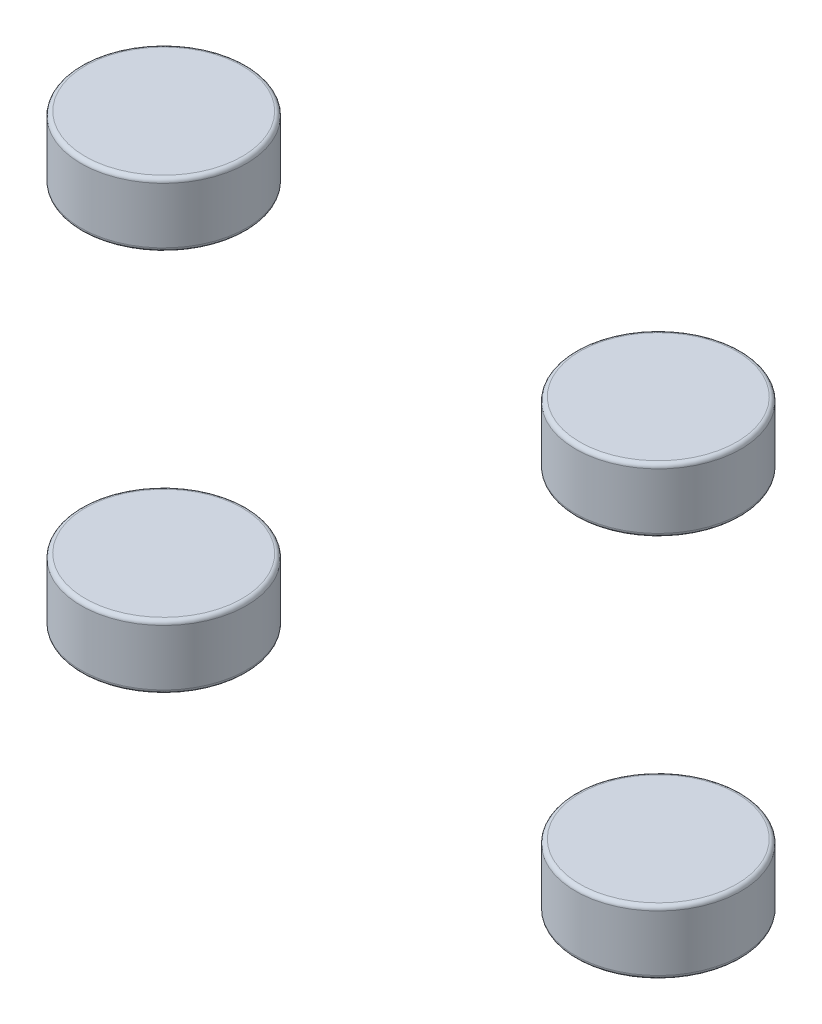
from build123d import *

# Parameters (mm, degrees)
LEFT_WHEELS_DEPTH         = 100.5
LEFT_WHEELS_DEPTH_BACK    = 100.5
F_3D_SKETCH_1_R           = 259
LEFT_WHEELS_2_DEPTH       = 100.5
LEFT_WHEELS_2_DEPTH_BACK  = 100.5
FILLET1_R                 = 13
FILLET2_R                 = 13
RIGHT_WHEELS_DEPTH        = 100.5
RIGHT_WHEELS_DEPTH_BACK   = 100.5
F_3DSKETCH3_R             = 259
RIGHT_WHEELS_2_DEPTH      = 100.5
RIGHT_WHEELS_2_DEPTH_BACK = 100.5
FILLET4_R                 = 13
FILLET3_R                 = 13


with BuildPart() as part:
    # 3D Sketch 1 → Left Wheels (new, two sides: drawn at the far end of the back side and taken through both)
    with BuildSketch(Plane(origin=(-420, -600, 235), x_dir=(0, 0, 1), z_dir=(0, 1, 0)).offset(-LEFT_WHEELS_DEPTH_BACK)):
        Circle(F_3D_SKETCH_1_R)
    extrude(amount=LEFT_WHEELS_DEPTH + LEFT_WHEELS_DEPTH_BACK)

    # Fillet2
    fillet2_edges = [part.edges().sort_by_distance(p)[0] for p in [
        (-420, -700.5, -24),
        (-420, -499.5, -24),
    ]]
    fillet(fillet2_edges, radius=FILLET2_R)


with BuildPart() as body_2:
    # 3D Sketch 1 → Left Wheels 2 (new, two sides: drawn at the far end of the back side and taken through both)
    with BuildSketch(Plane(origin=(-420, -600, 235), x_dir=(0, 0, 1), z_dir=(0, 1, 0)).offset(-LEFT_WHEELS_2_DEPTH_BACK)):
        with Locations((0, 1550)):
            Circle(F_3D_SKETCH_1_R)
    extrude(amount=LEFT_WHEELS_2_DEPTH + LEFT_WHEELS_2_DEPTH_BACK)

    # Fillet1
    fillet1_edges = [body_2.edges().sort_by_distance(p)[0] for p in [
        (1130, -700.5, -24),
        (1130, -499.5, -24),
    ]]
    fillet(fillet1_edges, radius=FILLET1_R)


with BuildPart() as body_3:
    # 3DSketch3 → Right Wheels (new, two sides: drawn at the far end of the back side and taken through both)
    with BuildSketch(Plane(origin=(1130, 600, 235), x_dir=(0, 0, 1), z_dir=(0, -1, 0)).offset(-RIGHT_WHEELS_DEPTH_BACK)):
        Circle(F_3DSKETCH3_R)
    extrude(amount=RIGHT_WHEELS_DEPTH + RIGHT_WHEELS_DEPTH_BACK)

    # Fillet3
    fillet3_edges = [body_3.edges().sort_by_distance(p)[0] for p in [
        (1130, 499.5, -24),
        (1130, 700.5, -24),
    ]]
    fillet(fillet3_edges, radius=FILLET3_R)


with BuildPart() as body_4:
    # 3DSketch3 → Right Wheels 2 (new, two sides: drawn at the far end of the back side and taken through both)
    with BuildSketch(Plane(origin=(1130, 600, 235), x_dir=(0, 0, 1), z_dir=(0, -1, 0)).offset(-RIGHT_WHEELS_2_DEPTH_BACK)):
        with Locations((0, 1550)):
            Circle(F_3DSKETCH3_R)
    extrude(amount=RIGHT_WHEELS_2_DEPTH + RIGHT_WHEELS_2_DEPTH_BACK)

    # Fillet4
    fillet4_edges = [body_4.edges().sort_by_distance(p)[0] for p in [
        (-420, 499.5, -24),
        (-420, 700.5, -24),
    ]]
    fillet(fillet4_edges, radius=FILLET4_R)


solid = Compound([part.part, body_2.part, body_3.part, body_4.part])
